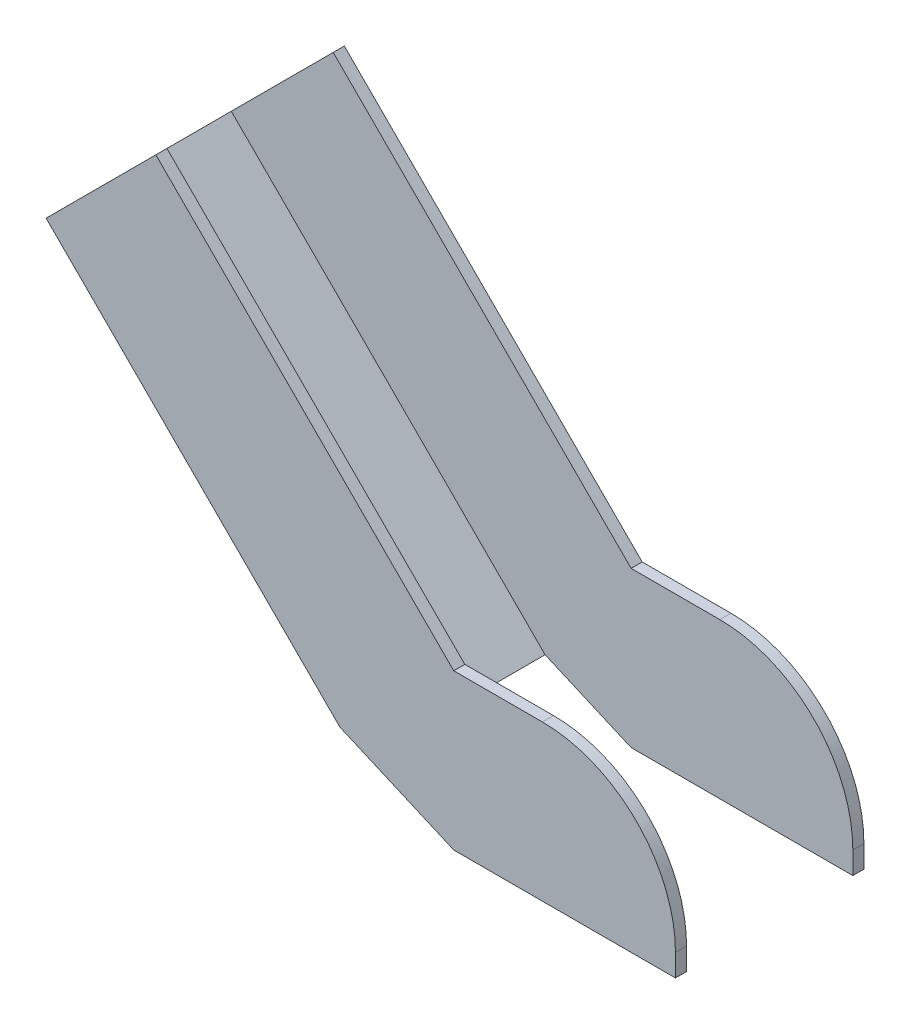
from build123d import *

# Parameters (mm, degrees)
BOSS_EXTRUDE1_DEPTH = 42.5
SHELL3_T            = -2.5


with BuildPart() as part:
    # Sketch1 → Boss-Extrude1 (new body)
    with BuildSketch(Plane.XY):
        with BuildLine():
            Line((-30, 0), (-50, 0))
            Line((-50, 0), (-117.175144213, 67.175144213))
            Line((-117.175144213, 67.175144213), (-141.923881554, 42.426406871))
            Line((-141.923881554, 42.426406871), (-75.648177206, -23.849297477))
            Line((-75.648177206, -23.849297477), (-50, -35))
            Line((-50, -35), (0, -35))
            Line((0, -35), (0, -30))
            ThreePointArc((0, -30), (-8.786796564, -8.786796564), (-30, 0))
        make_face()
    extrude(amount=BOSS_EXTRUDE1_DEPTH)

    # Shell3
    shell3_openings = [part.faces().sort_by_distance(p)[0] for p in [
        (0, -32.5, 21.25),
        (-40, 0, 21.25),
        (-83.587572106, 33.587572106, 21.25),
        (-129.549512883, 54.800775542, 21.25),
        (-8.786796564, -8.786796564, 21.25),
        (-25, -35, 21.25),
        (-62.824088603, -29.424648738, 21.25),
    ]]
    offset(amount=SHELL3_T, openings=shell3_openings, kind=Kind.INTERSECTION)


solid = part.part
